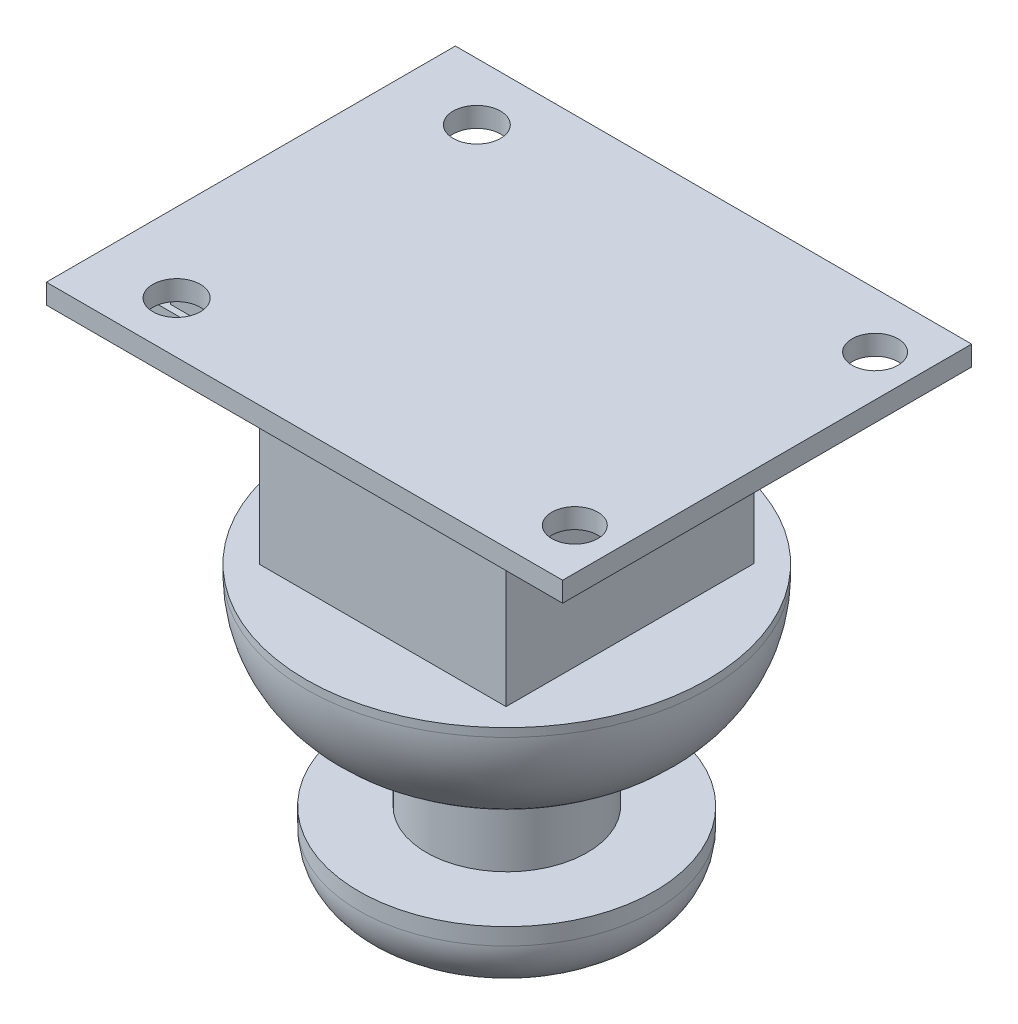
from build123d import *

# Parameters (mm, degrees)
SKETCH_1_W      = 33.7
SKETCH_1_H      = 26.7
SKETCH_1_R      = 1.500160794
SKETCH_1_R_2    = 1.5
SKETCH_1_R_3    = 1.552324123
SKETCH_1_R_4    = 1.546482565
EXTRUDE_1_DEPTH = 1.3
SKETCH_2_W      = 2.597810981
SKETCH_2_H      = 12.596422695
EXTRUDE_3_DEPTH = 2.6
SKETCH_3_W      = 0.801502227
SKETCH_3_H      = 0.800416217
SKETCH_3_H_2    = 0.802091773
SKETCH_3_H_3    = 0.798469443
SKETCH_3_H_4    = 0.802947908
SKETCH_3_H_5    = 0.804334784
SKETCH_6_W      = 16.101670469
SKETCH_6_H      = 16.19878198
EXTRUDE_4_DEPTH = 12.4
SKETCH_7_R      = 13.101940721
EXTRUDE_5_DEPTH = 8.4
FILLET_1_R      = 7.85
SKETCH_9_R      = 5.251940721
EXTRUDE_6_DEPTH = 5.3
SKETCH_12_R     = 9.651169133
EXTRUDE_8_DEPTH = 4.6
FILLET_2_R      = 3.5


with BuildPart() as part:
    # Эскиз1 → Бобышка-Вытянуть1 (new body)
    with BuildSketch(Plane(origin=(0, 0, 0), x_dir=(1, 0, 0), z_dir=(0, 1, 0))):
        with Locations((16.85, 13.35)):
            Rectangle(SKETCH_1_W, SKETCH_1_H)
        with Locations((30.998263896, 3.498646338)):
            Circle(SKETCH_1_R, mode=Mode.SUBTRACT)
        with Locations((30.998263896, 23.098469173)):
            Circle(SKETCH_1_R_2, mode=Mode.SUBTRACT)
        with Locations((5.150482455, 3.352746683)):
            Circle(SKETCH_1_R_3, mode=Mode.SUBTRACT)
        with Locations((5.150482455, 22.950000581)):
            Circle(SKETCH_1_R_4, mode=Mode.SUBTRACT)
    extrude(amount=EXTRUDE_1_DEPTH)

    # Эскиз2 → Бобышка-Вытянуть3 (add)
    with BuildSketch(Plane.XZ):
        with Locations((2.697533257, -12.993800664)):
            Rectangle(SKETCH_2_W, SKETCH_2_H)
    extrude(amount=EXTRUDE_3_DEPTH)

    # По траектории3: sweep along a path in Эскиз4
    with BuildLine(Plane.XY) as sweep_3_path:
        Line((2.697117024, -2.6), (2.697117024, -3.4))
        ThreePointArc((2.697117024, -3.4), (2.404223805, -4.107106781), (1.697117024, -4.4))
        Line((1.697117024, -4.4), (-4.903035907, -4.4))
    # Эскиз3 → По траектории3 (sweep)
    with BuildSketch(Plane.XZ.offset(2.6)):
        with Locations((2.697117024, -18.090816879)):
            Rectangle(SKETCH_3_W, SKETCH_3_H)
        with Locations((2.697117024, -15.69317288)):
            Rectangle(SKETCH_3_W, SKETCH_3_H_2)
        with Locations((2.697117024, -13.090941171)):
            Rectangle(SKETCH_3_W, SKETCH_3_H_3)
        with Locations((2.697117024, -10.688983068)):
            Rectangle(SKETCH_3_W, SKETCH_3_H_4)
        with Locations((2.697117024, -8.082021693)):
            Rectangle(SKETCH_3_W, SKETCH_3_H_5)
    sweep(path=sweep_3_path.line)

    # Эскиз6 → Бобышка-Вытянуть4 (add)
    with BuildSketch(Plane.XZ):
        with Locations((17.251381143, -12.805593049)):
            Rectangle(SKETCH_6_W, SKETCH_6_H)
    extrude(amount=EXTRUDE_4_DEPTH)

    # Эскиз7 → Бобышка-Вытянуть5 (add)
    with BuildSketch(Plane.XZ.offset(12.4)):
        with Locations((17.251381142, -12.805593049)):
            Circle(SKETCH_7_R)
    extrude(amount=EXTRUDE_5_DEPTH)

    # Скругление1
    fillet_1_edges = [part.edges().sort_by_distance(p)[0] for p in [
        (4.149440422, -20.8, -12.805593049),
    ]]
    fillet(fillet_1_edges, radius=FILLET_1_R)

    # Эскиз9 → Бобышка-Вытянуть6 (add)
    with BuildSketch(Plane.XZ.offset(20.8)):
        with Locations((17.251381142, -12.805593049)):
            Circle(SKETCH_9_R)
    extrude(amount=EXTRUDE_6_DEPTH)

    # Эскиз12 → Бобышка-Вытянуть8 (add)
    with BuildSketch(Plane.XZ.offset(26.1)):
        with Locations((17.236348133, -12.810976669)):
            Circle(SKETCH_12_R)
    extrude(amount=EXTRUDE_8_DEPTH)

    # Скругление2
    fillet_2_edges = [part.edges().sort_by_distance(p)[0] for p in [
        (7.585179, -30.7, -12.810976669),
    ]]
    fillet(fillet_2_edges, radius=FILLET_2_R)


solid = part.part
